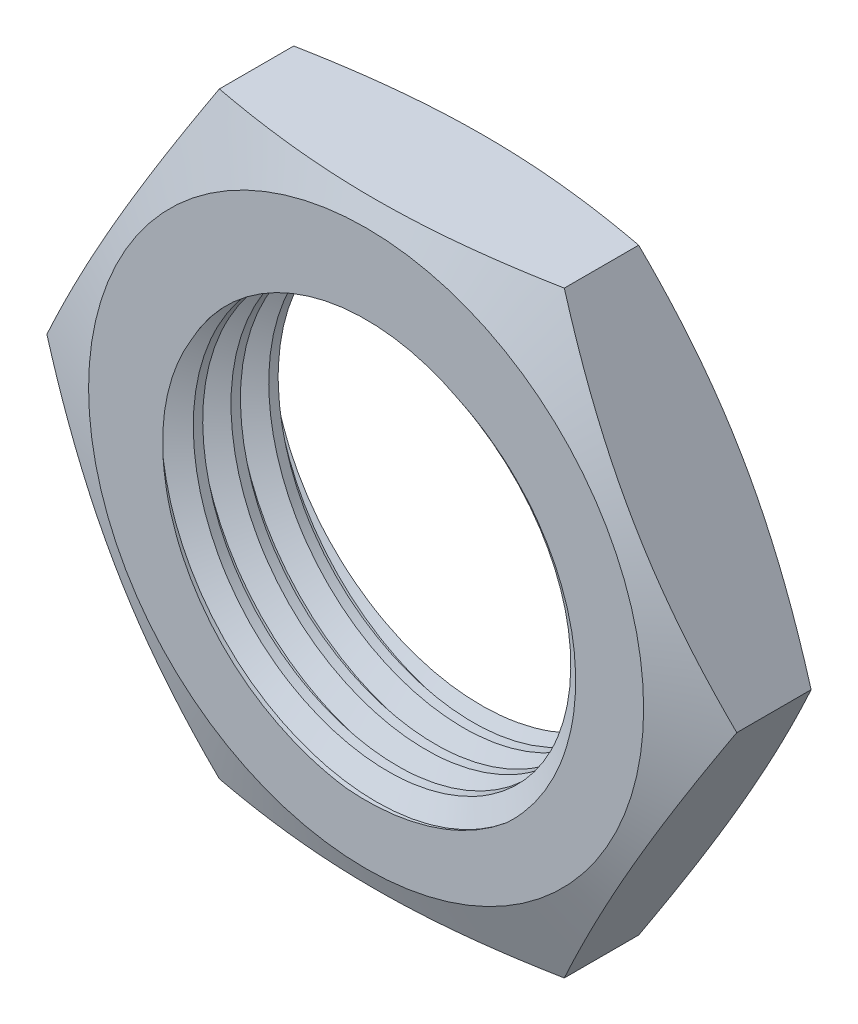
from build123d import *

# Parameters (mm, degrees)
SKETCH1_R           = 3.15
BOSS_EXTRUDE1_DEPTH = 2
THREAD1_PITCH       = 0.6


with BuildPart() as part:
    # Sketch1 → Boss-Extrude1 (new body)
    with BuildSketch(Plane.XY):
        Polygon((5.484827557, 0), (2.742413779, 4.75), (-2.742413779, 4.75), (-5.484827557, 0), (-2.742413779, -4.75), (2.742413779, -4.75), align=None)
        Circle(SKETCH1_R, mode=Mode.SUBTRACT)
    extrude(amount=BOSS_EXTRUDE1_DEPTH)

    # Sketch2 → Cut-Revolve4 (revolve, cut)
    with BuildSketch(Plane(origin=(0, 0, 0), x_dir=(0, 0, -1), z_dir=(1, 0, 0)), mode=Mode.PRIVATE) as cut_revolve4_sk:
        Polygon((-1.218023808, 6.463265076), (-3.717130493, 6.463265076), (-3.717130493, 2.569480911), (-2.701898203, 2.57225525), align=None)
    cut_revolve4 = revolve(cut_revolve4_sk.sketch.rotate(Axis((0, 0, 1.218023808), (0, 0, 1)), 270), axis=Axis((0, 0, 1.218023808), (0, 0, 1)), mode=Mode.SUBTRACT)

    # Mirror1: Cut-Revolve4 across plane
    add(cut_revolve4.mirror(Plane(origin=(0, 0, 1), x_dir=(1, 0, 0), z_dir=(0, 0, -1))), mode=Mode.SUBTRACT)

    # Thread1: the profile of Thread Profile1 profile screwed along a right-hand helix of 8.333333 turns, 6 arcs to a turn; built about Z, then put on its axis
    thread1_z = Axis((0, 0, 0), (0, 0, 1))
    thread1_corners = [(3.1497, -1e-09, -0.000173205), (3.474759525, -1e-09, 0.187499999), (3.474759525, -1e-09, 0.262499999), (3.1497, -1e-09, 0.450173203)]
    with BuildLine(mode=Mode.PRIVATE) as thread1_profile:
        Line(thread1_corners[0], thread1_corners[1])
        Line(thread1_corners[1], thread1_corners[2])
        Line(thread1_corners[2], thread1_corners[3])
        Line(thread1_corners[3], thread1_corners[0])
    thread1_cap = Face(thread1_profile.wire())
    thread1_turn_angles = [0, 30, 60, 90, 120, 150, 180, 210, 240, 270, 300, 330, 360]
    thread1_turn_weights = [1, 0.8660254037844387, 1, 0.8660254037844387, 1, 0.8660254037844387, 1, 0.8660254037844387, 1, 0.8660254037844387, 1, 0.8660254037844387, 1]
    thread1_turn_rails = [Edge.make_bspline([Vector(p[0], p[1], 0).rotate(thread1_z, thread1_turn_angles[k]) / thread1_turn_weights[k] + Vector(0, 0, p[2] + THREAD1_PITCH * thread1_turn_angles[k] / 360) for k in range(13)], [0, 0, 0, 1, 1, 2, 2, 3, 3, 4, 4, 5, 5, 6, 6, 6], 2, thread1_turn_weights) for p in thread1_corners]
    thread1_turn_sides = [Face.make_surface_from_curves(thread1_turn_rails[p[0]], thread1_turn_rails[p[1]]) for p in [(0, 1), (1, 2), (2, 3), (3, 0)]]
    thread1_last_angles = [2880, 2910, 2940, 2970, 3000]
    thread1_last_weights = [1, 0.8660254037844387, 1, 0.8660254037844387, 1]
    thread1_last_rails = [Edge.make_bspline([Vector(p[0], p[1], 0).rotate(thread1_z, thread1_last_angles[k]) / thread1_last_weights[k] + Vector(0, 0, p[2] + THREAD1_PITCH * thread1_last_angles[k] / 360) for k in range(5)], [0, 0, 0, 1, 1, 2, 2, 2], 2, thread1_last_weights) for p in thread1_corners]
    thread1_last_sides = [Face.make_surface_from_curves(thread1_last_rails[p[0]], thread1_last_rails[p[1]]) for p in [(0, 1), (1, 2), (2, 3), (3, 0)]]
    thread1 = Plane(origin=(0, 0, -0.5), x_dir=(0.999390827, 0.034899497, 0), z_dir=(0, 0, 1)) * Solid(Shell([*[p.moved(Location((0, 0, THREAD1_PITCH * i))) for i in range(8) for p in thread1_turn_sides], *thread1_last_sides, thread1_cap, thread1_cap.rotate(thread1_z, 3000).moved(Location((0, 0, THREAD1_PITCH * 3000 / 360)))]))
    add(thread1, mode=Mode.SUBTRACT)


solid = part.part
